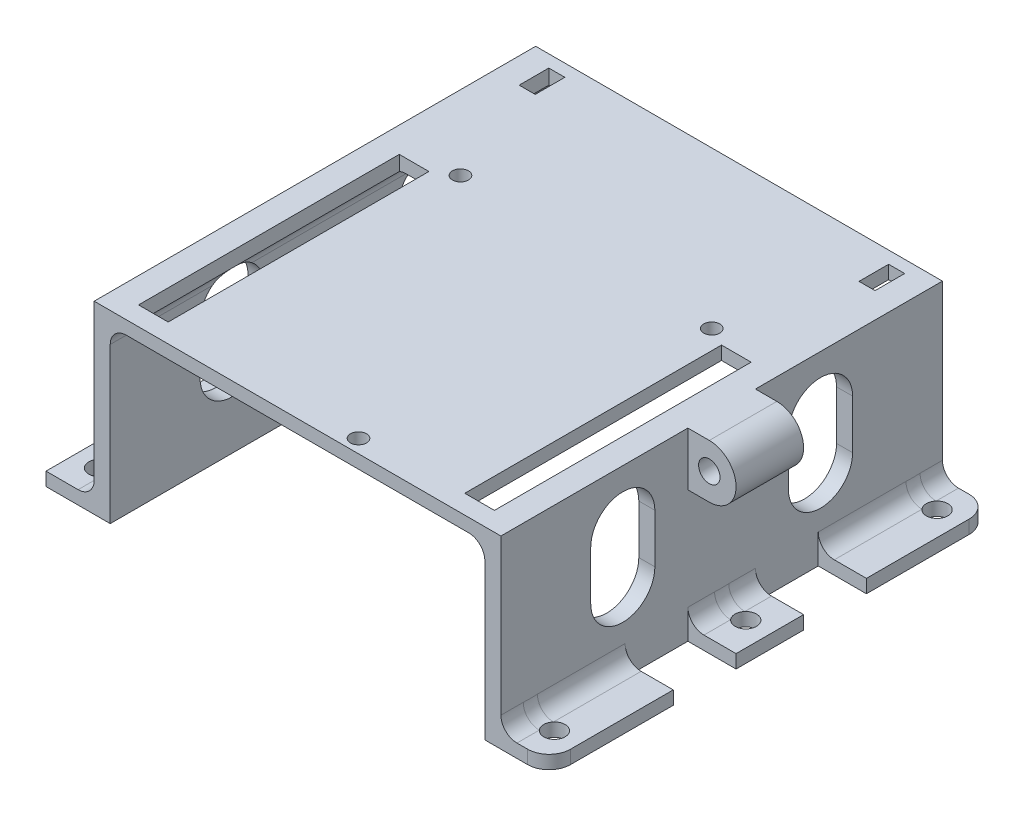
from build123d import *

# Parameters (mm, degrees)
SKETCH1_W                       = 9
SKETCH1_H                       = 82.5
SKETCH1_R                       = 2
BOSS_EXTRUDE1_DEPTH             = 2.5
BOSS_EXTRUDE1_2_DEPTH           = 2.5
SKETCH1_3_W                     = 3
SKETCH1_3_H                     = 82.5
BOSS_EXTRUDE2_DEPTH             = 32
BOSS_EXTRUDE3_START             = 32
SKETCH1_5_W                     = 3
SKETCH1_5_H                     = 82.5
SKETCH1_5_W_2                   = 70
BOSS_EXTRUDE3_DEPTH             = 2.5
FILLET1_R                       = 3
FILLET2_R                       = 4
CUT_EXTRUDE1_DEPTH              = 71.246441191
CUT_EXTRUDE1_DEPTH_BACK         = 71.246441191
SKETCH2_W                       = 10.01007541
SKETCH2_H                       = 11.735859756
FILLET4_R                       = 3
CUT_EXTRUDE2_DEPTH              = 101.58236682
CUT_EXTRUDE2_DEPTH_BACK         = 101.58236682
CUT_EXTRUDE3_DEPTH              = 72.419972803
CUT_EXTRUDE3_DEPTH_BACK         = 72.419972803
SKETCH4_R                       = 1.5
SKETCH4_W                       = 5.54
SKETCH4_H                       = 48.72
SKETCH4_H_2                     = 47.97
SKETCH4_W_2                     = 3
SKETCH4_H_3                     = 5.54
BOSS_EXTRUDE4_REACH             = 73.42
SKETCH5_R                       = 2
BOSS_EXTRUDE4_DIRECTION_2_REACH = 73.42


with BuildPart() as part:
    # Sketch1 → Boss-Extrude1 (new body)
    with BuildSketch(Plane(origin=(0, 0, 0), x_dir=(1, 0, 0), z_dir=(0, 1, 0))):
        with Locations((-42.5, 0)):
            Rectangle(SKETCH1_W, SKETCH1_H)
        with Locations(Location((-42.5, 35.75, 0), (0, 0, 270))):
            Circle(SKETCH1_R, mode=Mode.SUBTRACT)
        with Locations(Location((-42.5, -35.75, 0), (0, 0, 270))):
            Circle(SKETCH1_R, mode=Mode.SUBTRACT)
        with Locations(Location((-42.5, 0, 0), (0, 0, 270))):
            Circle(SKETCH1_R, mode=Mode.SUBTRACT)
    extrude(amount=BOSS_EXTRUDE1_DEPTH)



with BuildPart() as body_2:
    # Sketch1 → Boss-Extrude1 2 (new body)
    with BuildSketch(Plane(origin=(0, 0, 0), x_dir=(1, 0, 0), z_dir=(0, 1, 0))):
        with Locations((42.5, 0)):
            Rectangle(SKETCH1_W, SKETCH1_H)
        with Locations(Location((42.5, -35.75, 0), (0, 0, 270))):
            Circle(SKETCH1_R, mode=Mode.SUBTRACT)
        with Locations(Location((42.5, 35.75, 0), (0, 0, 270))):
            Circle(SKETCH1_R, mode=Mode.SUBTRACT)
        with Locations(Location((42.5, 0, 0), (0, 0, 270))):
            Circle(SKETCH1_R, mode=Mode.SUBTRACT)
    extrude(amount=BOSS_EXTRUDE1_2_DEPTH)


with BuildPart() as part_1:
    add(part.part)

    add(body_2.part)  # Boss-Extrude2 merges body 2
    # Sketch1<3> → Boss-Extrude2 (add)
    with BuildSketch(Plane(origin=(0, 0, 0), x_dir=(1, 0, 0), z_dir=(0, 1, 0))):
        with Locations((-36.5, 0)):
            Rectangle(SKETCH1_3_W, SKETCH1_3_H)
        with Locations((36.5, 0)):
            Rectangle(SKETCH1_3_W, SKETCH1_3_H)
    extrude(amount=BOSS_EXTRUDE2_DEPTH)

    # Sketch1<5> → Boss-Extrude3 (add)
    with BuildSketch(Plane(origin=(0, 0, 0), x_dir=(1, 0, 0), z_dir=(0, 1, 0)).offset(BOSS_EXTRUDE3_START)):
        with Locations((-36.5, 0)):
            Rectangle(SKETCH1_5_W, SKETCH1_5_H)
        with Locations((36.5, 0)):
            Rectangle(SKETCH1_5_W, SKETCH1_5_H)
        Rectangle(SKETCH1_5_W_2, SKETCH1_5_H)
    extrude(amount=BOSS_EXTRUDE3_DEPTH)

    # Fillet1
    fillet1_edges = [part_1.edges().sort_by_distance(p)[0] for p in [
        (-35, 32, 0),
        (35, 32, 0),
    ]]
    fillet(fillet1_edges, radius=FILLET1_R)

    # Fillet2
    fillet2_edges = [part_1.edges().sort_by_distance(p)[0] for p in [
        (47, 1.25, -41.25),
        (47, 1.25, 41.25),
    ]]
    fillet(fillet2_edges, radius=FILLET2_R)

    # Sketch2 → Cut-Extrude1 (cut, two sides: drawn at the far end of the back side and taken through both)
    with BuildSketch(Plane(origin=(0, 2.5, 0), x_dir=(1, 0, 0), z_dir=(0, 1, 0)).offset(-CUT_EXTRUDE1_DEPTH_BACK)):
        with Locations((43.005037705, 12.17856586)):
            Rectangle(SKETCH2_W, SKETCH2_H)
        with Locations((43.005037705, -12.17856586)):
            Rectangle(SKETCH2_W, SKETCH2_H)
    extrude(amount=CUT_EXTRUDE1_DEPTH + CUT_EXTRUDE1_DEPTH_BACK, mode=Mode.SUBTRACT)

    # Fillet4
    fillet4_edges = [part_1.edges().sort_by_distance(p)[0] for p in [
        (38, 2.5, 0),
        (38, 2.5, 29.648247869),
        (-38, 2.5, 0),
        (38, 2.5, -29.648247869),
    ]]
    fillet(fillet4_edges, radius=FILLET4_R)

    # Sketch3 → Cut-Extrude2 (cut, two sides: drawn at the far end of the back side and taken through both)
    with BuildSketch(Plane.ZY.offset(38).offset(-CUT_EXTRUDE2_DEPTH_BACK)):
        with BuildLine():
            Line((12.483303601, 15.128001213), (12.483303601, 24.282431388))
            ThreePointArc((12.483303601, 24.282431388), (18.473305415, 30.272433202), (24.46330723, 24.282431388))
            Line((24.46330723, 24.282431388), (24.46330723, 15.128001213))
            ThreePointArc((24.46330723, 15.128001213), (18.473305415, 9.137999399), (12.483303601, 15.128001213))
        make_face()
        with BuildLine():
            Line((-12.483303601, 15.128001213), (-12.483303601, 24.282431388))
            ThreePointArc((-12.483303601, 24.282431388), (-18.473305415, 30.272433202), (-24.46330723, 24.282431388))
            Line((-24.46330723, 24.282431388), (-24.46330723, 15.128001213))
            ThreePointArc((-24.46330723, 15.128001213), (-18.473305415, 9.137999399), (-12.483303601, 15.128001213))
        make_face()
    extrude(amount=CUT_EXTRUDE2_DEPTH + CUT_EXTRUDE2_DEPTH_BACK, mode=Mode.SUBTRACT)

    # Sketch4 → Cut-Extrude3 (cut, two sides: drawn at the far end of the back side and taken through both)
    with BuildSketch(Plane(origin=(0, 34.5, 0), x_dir=(1, 0, 0), z_dir=(0, 1, 0)).offset(-CUT_EXTRUDE3_DEPTH_BACK)):
        with Locations(Location((-24.13, 13.32, 0), (0, 0, 90))):
            Circle(SKETCH4_R)
        with Locations(Location((24.13, 12.03, 0), (0, 0, 90))):
            Circle(SKETCH4_R)
        with Locations(Location((8.89, -38.75, 0), (0, 0, 90))):
            Circle(SKETCH4_R)
        with Locations((-30.48, -13.35)):
            Rectangle(SKETCH4_W, SKETCH4_H)
        with Locations((30.48, -13.725)):
            Rectangle(SKETCH4_W, SKETCH4_H_2)
        with Locations((-31.75, 36.18)):
            Rectangle(SKETCH4_W_2, SKETCH4_H_3)
        with Locations((31.75, 36.18)):
            Rectangle(SKETCH4_W_2, SKETCH4_H_3)
    extrude(amount=CUT_EXTRUDE3_DEPTH + CUT_EXTRUDE3_DEPTH_BACK, mode=Mode.SUBTRACT)

    # Boss-Extrude4: up to this face of the body (flat: up to its plane)
    boss_extrude4_end = Plane(part_1.part.faces().sort_by_distance((42.197228984, 1.401793092, 6.310635982))[0])
    # Sketch5 → Boss-Extrude4 (add, up to the picked face)
    with BuildSketch(Plane.XY, mode=Mode.PRIVATE) as boss_extrude4_sk1:
        with BuildLine():
            ThreePointArc((42, 34.5), (47, 29.5), (42, 24.5))
            Line((42, 24.5), (38, 24.5))
            Line((38, 24.5), (38, 34.5))
            Line((38, 34.5), (42, 34.5))
        make_face()
        with Locations(Location((42, 29.5, 0), (0, 0, 180))):
            Circle(SKETCH5_R, mode=Mode.SUBTRACT)
    boss_extrude4_tool1 = split(extrude(boss_extrude4_sk1.sketch, amount=BOSS_EXTRUDE4_REACH, mode=Mode.PRIVATE), bisect_by=boss_extrude4_end, keep=Keep.BOTH, mode=Mode.PRIVATE)
    add(boss_extrude4_tool1.solids().sort_by(Axis((46.865464, 29.5, 0), (0, 0, 1)))[0])

    # Boss-Extrude4 direction 2: up to this face of the body (flat: up to its plane)
    boss_extrude4_direction_2_end = Plane(part_1.part.faces().sort_by_distance((42.197228984, 1.401793092, -6.310635982))[0])
    # Sketch5 → Boss-Extrude4 direction 2 (add, up to the picked face)
    with BuildSketch(Plane.XY, mode=Mode.PRIVATE) as boss_extrude4_direction_2_sk1:
        with BuildLine():
            ThreePointArc((42, 34.5), (47, 29.5), (42, 24.5))
            Line((42, 24.5), (38, 24.5))
            Line((38, 24.5), (38, 34.5))
            Line((38, 34.5), (42, 34.5))
        make_face()
        with Locations(Location((42, 29.5, 0), (0, 0, 180))):
            Circle(SKETCH5_R, mode=Mode.SUBTRACT)
    boss_extrude4_direction_2_tool1 = split(extrude(boss_extrude4_direction_2_sk1.sketch, amount=-BOSS_EXTRUDE4_DIRECTION_2_REACH, mode=Mode.PRIVATE), bisect_by=boss_extrude4_direction_2_end, keep=Keep.BOTH, mode=Mode.PRIVATE)
    add(boss_extrude4_direction_2_tool1.solids().sort_by(Axis((46.865464, 29.5, 0), (0, 0, -1)))[0])


solid = part_1.part
